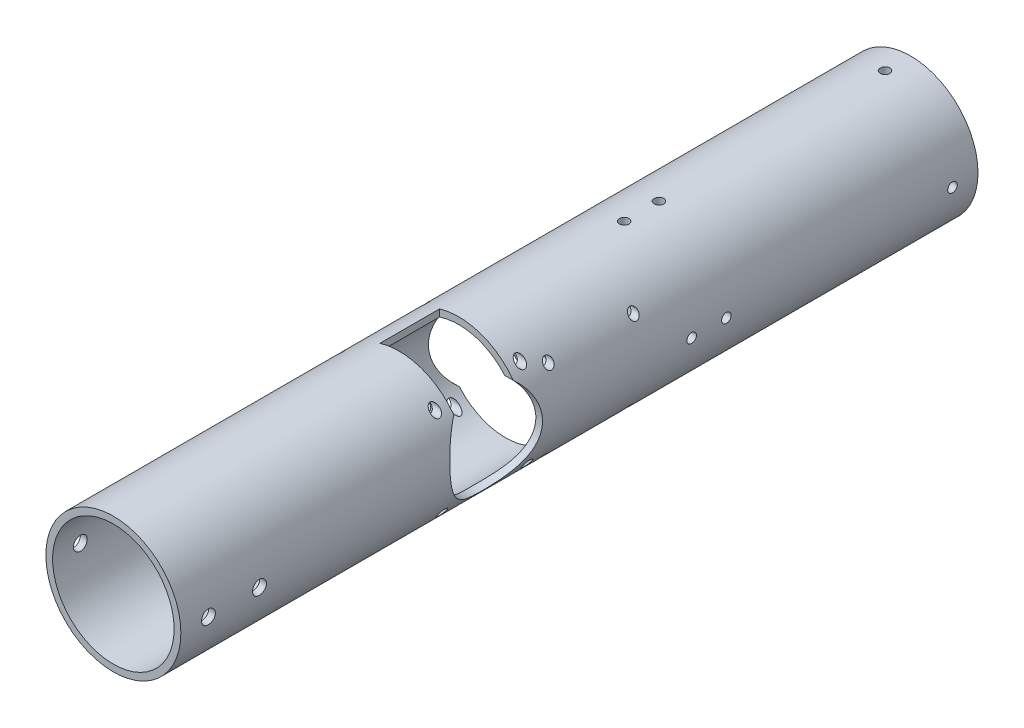
from build123d import *

# Parameters (mm, degrees)
BOSS_EXTRUDE1_DEPTH           = 125
BOSS_EXTRUDE1_DEPTH_BACK      = 250
SKETCH1_R                     = 31.75
SKETCH1_R_2                   = 28.575
SKETCH2_R                     = 21.75
CUT_EXTRUDE1_DEPTH            = 255.000246063
SKETCH3_R                     = 21.75
CUT_EXTRUDE2_DEPTH            = 255.000246187
CUT_EXTRUDE4_START            = 9
SKETCH5_W                     = 28
SKETCH5_H                     = 22
CUT_EXTRUDE4_DEPTH            = 264.000246187
CUT_EXTRUDE5_START            = -9
SKETCH6_W                     = 28
SKETCH6_H                     = 22
CUT_EXTRUDE5_DEPTH            = 264.000246187
CUT_EXTRUDE8_DEPTH            = 255.000246187
CUT_EXTRUDE8_DEPTH_BACK       = 255.000246187
SKETCH11_R                    = 2
CUT_EXTRUDE10_DEPTH           = 255.000246187
CUT_EXTRUDE10_DEPTH_BACK      = 255.000246187
SKETCH12_R                    = 3.25
SKETCH13_R                    = 2.25
CUT_EXTRUDE11_DEPTH           = 255.000246187
CUT_EXTRUDE12_DEPTH           = 255.000246187
CUT_EXTRUDE12_DEPTH_BACK      = 255.000246187
SKETCH15_R                    = 2
SKETCH19_W                    = 2.25
SKETCH19_H                    = 31.75
M4_CLEARANCE_HOLE1_AT_2_COUNT = 2
M4_CLEARANCE_HOLE1_AT_2_PITCH = 40
M4_CLEARANCE_HOLE1_AT_3_COUNT = 2
M4_CLEARANCE_HOLE1_AT_3_PITCH = 40
M4_CLEARANCE_HOLE1_AT_4_COUNT = 2
M4_CLEARANCE_HOLE1_AT_4_PITCH = 56.568542495
M4_CLEARANCE_HOLE1_AT_5_COUNT = 2
M4_CLEARANCE_HOLE1_AT_5_PITCH = 90.126807577
M4_CLEARANCE_HOLE1_AT_6_COUNT = 2
M4_CLEARANCE_HOLE1_AT_6_PITCH = 50.197623888
M4_CLEARANCE_HOLE1_AT_7_COUNT = 2
M4_CLEARANCE_HOLE1_AT_7_PITCH = 100.213978286
M4_CLEARANCE_HOLE1_AT_8_COUNT = 2
M4_CLEARANCE_HOLE1_AT_8_PITCH = 66.631835064
MIRROR1_COPY_1_SKETCH_W       = 2.25
MIRROR1_COPY_1_SKETCH_H       = 31.75
MIRROR1_COPY_2_SKETCH_W       = 2.25
MIRROR1_COPY_2_SKETCH_H       = 31.75
MIRROR1_COPY_3_SKETCH_W       = 2.25
MIRROR1_COPY_3_SKETCH_H       = 31.75
MIRROR1_COPY_4_SKETCH_W       = 2.25
MIRROR1_COPY_4_SKETCH_H       = 31.75
MIRROR1_COPY_5_SKETCH_W       = 2.25
MIRROR1_COPY_5_SKETCH_H       = 31.75
MIRROR1_COPY_6_SKETCH_W       = 2.25
MIRROR1_COPY_6_SKETCH_H       = 31.75
MIRROR1_COPY_7_SKETCH_W       = 2.25
MIRROR1_COPY_7_SKETCH_H       = 31.75
SKETCH21_R                    = 30
CUT_EXTRUDE14_DEPTH           = 7
CIRPATTERN1_COUNT             = 2
CIRPATTERN1_ANGLE             = 90
SKETCH22_R                    = 2.25
CUT_EXTRUDE15_DEPTH           = 255.000246187
CIRPATTERN2_COUNT             = 4
SKETCH23_R                    = 30
SKETCH23_R_2                  = 28.575
BOSS_EXTRUDE2_DEPTH           = 7


with BuildPart() as part:
    # Sketch1 → Boss-Extrude1 (new, two sides: drawn at the far end of the back side and taken through both)
    with BuildSketch(Plane.XY.offset(-BOSS_EXTRUDE1_DEPTH_BACK)):
        Circle(SKETCH1_R)
        Circle(SKETCH1_R_2, mode=Mode.SUBTRACT)
    extrude(amount=BOSS_EXTRUDE1_DEPTH + BOSS_EXTRUDE1_DEPTH_BACK)

    # Sketch2 → Cut-Extrude1 (cut, through all)
    with BuildSketch(Plane(origin=(0, 0, 0), x_dir=(0, 0, -1), z_dir=(1, 0, 0))):
        with Locations((73.488, -2)):
            Circle(SKETCH2_R)
    extrude(amount=-CUT_EXTRUDE1_DEPTH, mode=Mode.SUBTRACT)

    # Sketch3 → Cut-Extrude2 (cut, through all)
    with BuildSketch(Plane(origin=(0, 0, 0), x_dir=(0, 0, -1), z_dir=(1, 0, 0))):
        with Locations(Location((23.45, 2, 0), (0, 0, 354.723969399))):
            Circle(SKETCH3_R)
    extrude(amount=CUT_EXTRUDE2_DEPTH, mode=Mode.SUBTRACT)

    # Sketch5 → Cut-Extrude4 (cut, through all)
    with BuildSketch(Plane(origin=(0, 0, 0), x_dir=(0, 0, -1), z_dir=(1, 0, 0)).offset(CUT_EXTRUDE4_START)):
        with Locations((73.488, -23.75)):
            Rectangle(SKETCH5_W, SKETCH5_H)
    extrude(amount=-CUT_EXTRUDE4_DEPTH, mode=Mode.SUBTRACT)

    # Sketch6 → Cut-Extrude5 (cut, through all)
    with BuildSketch(Plane(origin=(0, 0, 0), x_dir=(0, 0, -1), z_dir=(1, 0, 0)).offset(CUT_EXTRUDE5_START)):
        with Locations((23.45, 23.75)):
            Rectangle(SKETCH6_W, SKETCH6_H)
    extrude(amount=CUT_EXTRUDE5_DEPTH, mode=Mode.SUBTRACT)

    # Sketch11 → Cut-Extrude8 (cut, two sides: drawn at the far end of the back side and taken through both)
    with BuildSketch(Plane(origin=(0, 0, 0), x_dir=(0, 0, -1), z_dir=(1, 0, 0)).offset(-CUT_EXTRUDE8_DEPTH_BACK)):
        with Locations((93.488, 18)):
            Circle(SKETCH11_R)
        with Locations((53.488, 18)):
            Circle(SKETCH11_R)
        with Locations((53.488, -22)):
            Circle(SKETCH11_R)
        with Locations((93.488, -22)):
            Circle(SKETCH11_R)
    extrude(amount=CUT_EXTRUDE8_DEPTH + CUT_EXTRUDE8_DEPTH_BACK, mode=Mode.SUBTRACT)

    # Sketch12 → Cut-Extrude10 (cut, two sides: drawn at the far end of the back side and taken through both)
    with BuildSketch(Plane(origin=(0, 0, 0), x_dir=(0, 0, -1), z_dir=(1, 0, 0)).offset(-CUT_EXTRUDE10_DEPTH_BACK)):
        with Locations((-112, 0)):
            Circle(SKETCH12_R)
        with Locations((-88, 0)):
            Circle(SKETCH12_R)
    extrude(amount=CUT_EXTRUDE10_DEPTH + CUT_EXTRUDE10_DEPTH_BACK, mode=Mode.SUBTRACT)

    # Sketch13 → Cut-Extrude11 (cut, symmetric)
    with BuildSketch(Plane(origin=(0, 0, 0), x_dir=(1, 0, 0), z_dir=(0, 1, 0))):
        with Locations(Location((0, 238, 0), (0, 0, 270))):
            Circle(SKETCH13_R)
    cut_extrude11 = extrude(amount=CUT_EXTRUDE11_DEPTH, both=True, mode=Mode.SUBTRACT)

    # Sketch15 → Cut-Extrude12 (cut, two sides: drawn at the far end of the back side and taken through both)
    with BuildSketch(Plane(origin=(0, 0, 0), x_dir=(0, 0, -1), z_dir=(1, 0, 0)).offset(-CUT_EXTRUDE12_DEPTH_BACK)):
        with Locations((3.45, 22)):
            Circle(SKETCH15_R)
        with Locations((43.45, 22)):
            Circle(SKETCH15_R)
        with Locations((43.45, -18)):
            Circle(SKETCH15_R)
        with Locations((3.45, -18)):
            Circle(SKETCH15_R)
    extrude(amount=CUT_EXTRUDE12_DEPTH + CUT_EXTRUDE12_DEPTH_BACK, mode=Mode.SUBTRACT)

    # Sketch19 → M4 Clearance Hole1 (revolve, cut)
    with BuildSketch(Plane(origin=(0, 22, -3.45), x_dir=(0, 0, 1), z_dir=(0, 1, 0))):
        with Locations((1.125, 15.875)):
            Rectangle(SKETCH19_W, SKETCH19_H)
    m4_clearance_hole1 = revolve(axis=Axis((-6.35, 22, -3.45), (1, 0, 0)), mode=Mode.SUBTRACT)

    # M4 Clearance Hole1 at 2: M4 Clearance Hole1 ×2
    with Locations(*[(0, 0, -i * M4_CLEARANCE_HOLE1_AT_2_PITCH) for i in range(1, M4_CLEARANCE_HOLE1_AT_2_COUNT)]):
        add(m4_clearance_hole1, mode=Mode.SUBTRACT)

    # M4 Clearance Hole1 at 3: M4 Clearance Hole1 ×2
    with Locations(*[(0, -i * M4_CLEARANCE_HOLE1_AT_3_PITCH, 0) for i in range(1, M4_CLEARANCE_HOLE1_AT_3_COUNT)]):
        add(m4_clearance_hole1, mode=Mode.SUBTRACT)

    # M4 Clearance Hole1 at 4: M4 Clearance Hole1 ×2
    with Locations(*[Vector(0, -0.7071067811865478, -0.7071067811865472) * (i * M4_CLEARANCE_HOLE1_AT_4_PITCH) for i in range(1, M4_CLEARANCE_HOLE1_AT_4_COUNT)]):
        add(m4_clearance_hole1, mode=Mode.SUBTRACT)

    # M4 Clearance Hole1 at 5: M4 Clearance Hole1 ×2
    with Locations(*[Vector(0, -0.04438191152602306, -0.9990146374950151) * (i * M4_CLEARANCE_HOLE1_AT_5_PITCH) for i in range(1, M4_CLEARANCE_HOLE1_AT_5_COUNT)]):
        add(m4_clearance_hole1, mode=Mode.SUBTRACT)

    # M4 Clearance Hole1 at 6: M4 Clearance Hole1 ×2
    with Locations(*[Vector(0, -0.07968504662542611, -0.9968200907607669) * (i * M4_CLEARANCE_HOLE1_AT_6_PITCH) for i in range(1, M4_CLEARANCE_HOLE1_AT_6_COUNT)]):
        add(m4_clearance_hole1, mode=Mode.SUBTRACT)

    # M4 Clearance Hole1 at 7: M4 Clearance Hole1 ×2
    with Locations(*[Vector(0, -0.43906050585303297, -0.8984574960453493) * (i * M4_CLEARANCE_HOLE1_AT_7_PITCH) for i in range(1, M4_CLEARANCE_HOLE1_AT_7_COUNT)]):
        add(m4_clearance_hole1, mode=Mode.SUBTRACT)

    # M4 Clearance Hole1 at 8: M4 Clearance Hole1 ×2
    with Locations(*[Vector(0, -0.6603450131265124, -0.7509623583369185) * (i * M4_CLEARANCE_HOLE1_AT_8_PITCH) for i in range(1, M4_CLEARANCE_HOLE1_AT_8_COUNT)]):
        add(m4_clearance_hole1, mode=Mode.SUBTRACT)

    # Mirror1: M4 Clearance Hole1 across plane
    add(m4_clearance_hole1.mirror(Plane(origin=(0, 0, 0), x_dir=(0, 0, 1), z_dir=(1, 0, 0))), mode=Mode.SUBTRACT)

    # Mirror1 copy 1 sketch → Mirror1 copy 1 (revolve, cut)
    with BuildSketch(Plane(origin=(0, 22, -43.45), x_dir=(0, 0, 1), z_dir=(0, 1, 0))):
        with Locations((1.125, -15.875)):
            Rectangle(MIRROR1_COPY_1_SKETCH_W, MIRROR1_COPY_1_SKETCH_H)
    revolve(axis=Axis((6.35, 22, -43.45), (1, 0, 0)), mode=Mode.SUBTRACT)

    # Mirror1 copy 2 sketch → Mirror1 copy 2 (revolve, cut)
    with BuildSketch(Plane(origin=(0, -18, -3.45), x_dir=(0, 0, 1), z_dir=(0, 1, 0))):
        with Locations((1.125, -15.875)):
            Rectangle(MIRROR1_COPY_2_SKETCH_W, MIRROR1_COPY_2_SKETCH_H)
    revolve(axis=Axis((6.35, -18, -3.45), (1, 0, 0)), mode=Mode.SUBTRACT)

    # Mirror1 copy 3 sketch → Mirror1 copy 3 (revolve, cut)
    with BuildSketch(Plane(origin=(0, -18, -43.45), x_dir=(0, 0, 1), z_dir=(0, 1, 0))):
        with Locations((1.125, -15.875)):
            Rectangle(MIRROR1_COPY_3_SKETCH_W, MIRROR1_COPY_3_SKETCH_H)
    revolve(axis=Axis((6.35, -18, -43.45), (1, 0, 0)), mode=Mode.SUBTRACT)

    # Mirror1 copy 4 sketch → Mirror1 copy 4 (revolve, cut)
    with BuildSketch(Plane(origin=(0, 18, -93.488), x_dir=(0, 0, 1), z_dir=(0, 1, 0))):
        with Locations((1.125, -15.875)):
            Rectangle(MIRROR1_COPY_4_SKETCH_W, MIRROR1_COPY_4_SKETCH_H)
    revolve(axis=Axis((6.35, 18, -93.488), (1, 0, 0)), mode=Mode.SUBTRACT)

    # Mirror1 copy 5 sketch → Mirror1 copy 5 (revolve, cut)
    with BuildSketch(Plane(origin=(0, 18, -53.488), x_dir=(0, 0, 1), z_dir=(0, 1, 0))):
        with Locations((1.125, -15.875)):
            Rectangle(MIRROR1_COPY_5_SKETCH_W, MIRROR1_COPY_5_SKETCH_H)
    revolve(axis=Axis((6.35, 18, -53.488), (1, 0, 0)), mode=Mode.SUBTRACT)

    # Mirror1 copy 6 sketch → Mirror1 copy 6 (revolve, cut)
    with BuildSketch(Plane(origin=(0, -22, -93.488), x_dir=(0, 0, 1), z_dir=(0, 1, 0))):
        with Locations((1.125, -15.875)):
            Rectangle(MIRROR1_COPY_6_SKETCH_W, MIRROR1_COPY_6_SKETCH_H)
    revolve(axis=Axis((6.35, -22, -93.488), (1, 0, 0)), mode=Mode.SUBTRACT)

    # Mirror1 copy 7 sketch → Mirror1 copy 7 (revolve, cut)
    with BuildSketch(Plane(origin=(0, -22, -53.488), x_dir=(0, 0, 1), z_dir=(0, 1, 0))):
        with Locations((1.125, -15.875)):
            Rectangle(MIRROR1_COPY_7_SKETCH_W, MIRROR1_COPY_7_SKETCH_H)
    revolve(axis=Axis((6.35, -22, -53.488), (1, 0, 0)), mode=Mode.SUBTRACT)

    # Sketch21 → Cut-Extrude14 (cut)
    with BuildSketch(Plane(origin=(0, 0, -250), x_dir=(-1, 0, 0), z_dir=(0, 0, -1))):
        Circle(SKETCH21_R)
    extrude(amount=-CUT_EXTRUDE14_DEPTH, mode=Mode.SUBTRACT)

    # CirPattern1: Cut-Extrude11 ×2 about axis
    cirpattern1_axis = Axis((0, 0, -250), (0, 0, 1))
    for i in range(1, CIRPATTERN1_COUNT):
        add(cut_extrude11.rotate(cirpattern1_axis, i * CIRPATTERN1_ANGLE / (CIRPATTERN1_COUNT - 1)), mode=Mode.SUBTRACT)

    # Sketch22 → Cut-Extrude15 (cut, through all)
    with BuildSketch(Plane(origin=(0, 0, 0), x_dir=(0, 0, -1), z_dir=(1, 0, 0))):
        with Locations(Location((131.65, 0, 0), (0, 0, 180))):
            Circle(SKETCH22_R)
        with Locations(Location((115.3, 0, 0), (0, 0, 180))):
            Circle(SKETCH22_R)
    cut_extrude15 = extrude(amount=CUT_EXTRUDE15_DEPTH, mode=Mode.SUBTRACT)

    # CirPattern2: Cut-Extrude15 ×4 about axis
    cirpattern2_axis = Axis((0, 0, -250), (0, 0, 1))
    for i in range(1, CIRPATTERN2_COUNT):
        add(cut_extrude15.rotate(cirpattern2_axis, i * 360 / CIRPATTERN2_COUNT), mode=Mode.SUBTRACT)

    # Sketch23 → Boss-Extrude2 (add)
    with BuildSketch(Plane(origin=(0, 0, -243), x_dir=(-1, 0, 0), z_dir=(0, 0, -1))):
        Circle(SKETCH23_R)
        with Locations(Location((0, 0, 0), (0, 0, 180))):
            Circle(SKETCH23_R_2, mode=Mode.SUBTRACT)
    extrude(amount=BOSS_EXTRUDE2_DEPTH)


solid = part.part
